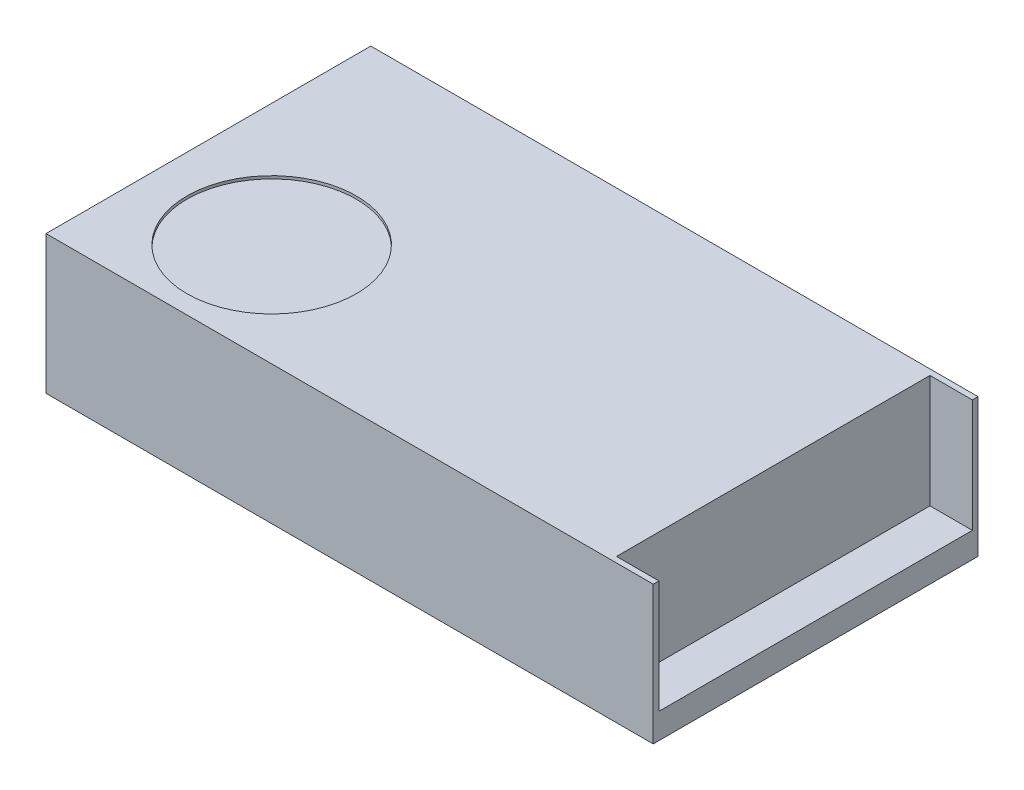
from build123d import *

# Parameters (mm, degrees)
SKETCH1_W           = 215
SKETCH1_H           = 115
BOSS_EXTRUDE1_DEPTH = 49
SKETCH2_R           = 30
CUT_EXTRUDE1_DEPTH  = 1
SKETCH4_W           = 15
SKETCH4_H           = 111
CUT_EXTRUDE2_DEPTH  = 40


with BuildPart() as part:
    # Sketch1 → Boss-Extrude1 (new body)
    with BuildSketch(Plane(origin=(0, 0, 0), x_dir=(1, 0, 0), z_dir=(0, 1, 0))):
        Rectangle(SKETCH1_W, SKETCH1_H)
    extrude(amount=BOSS_EXTRUDE1_DEPTH)

    # Sketch2 → Cut-Extrude1 (cut)
    with BuildSketch(Plane(origin=(0, 49, 0), x_dir=(1, 0, 0), z_dir=(0, 1, 0))):
        with Locations((-64.1, -21)):
            Circle(SKETCH2_R)
    extrude(amount=-CUT_EXTRUDE1_DEPTH, mode=Mode.SUBTRACT)

    # Sketch4 → Cut-Extrude2 (cut)
    with BuildSketch(Plane(origin=(0, 49, 0), x_dir=(1, 0, 0), z_dir=(0, 1, 0))):
        with Locations((100, 0)):
            Rectangle(SKETCH4_W, SKETCH4_H)
    extrude(amount=-CUT_EXTRUDE2_DEPTH, mode=Mode.SUBTRACT)


solid = part.part
